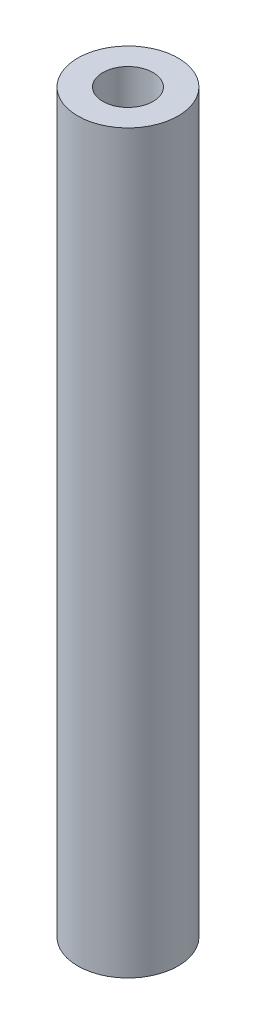
from build123d import *

# Parameters (mm, degrees)
SKETCH1_R           = 3
SKETCH1_R_2         = 1.5
BOSS_EXTRUDE1_DEPTH = 44


with BuildPart() as part:
    # Sketch1 → Boss-Extrude1 (new body)
    with BuildSketch(Plane(origin=(0, 0, 0), x_dir=(1, 0, 0), z_dir=(0, 1, 0))):
        Circle(SKETCH1_R)
        Circle(SKETCH1_R_2, mode=Mode.SUBTRACT)
    extrude(amount=BOSS_EXTRUDE1_DEPTH)


solid = part.part
